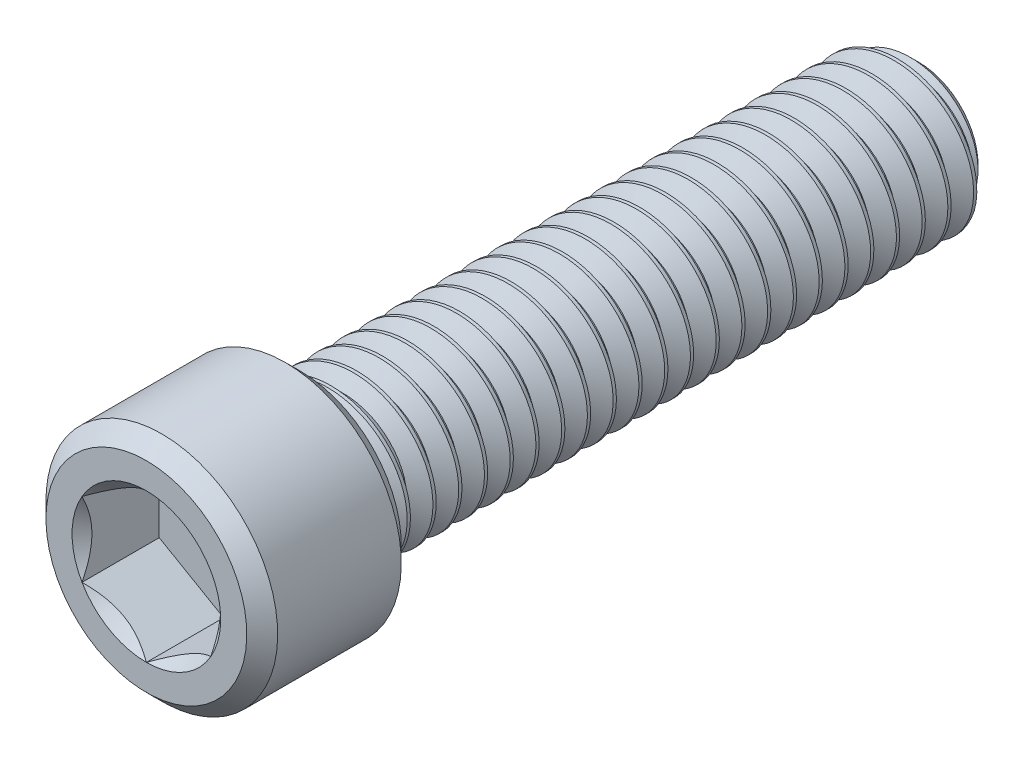
from build123d import *

# Parameters (mm, degrees)
CUT_EXTRUDE1_DEPTH = 4.7625
CUT_SWEEP1_PITCH   = 1.5875
CUT_SWEEP1_TO      = 38.1


with BuildPart() as part:
    # Sketch3 → Revolve1 (revolve)
    with BuildSketch(Plane(origin=(0, 0, 0), x_dir=(0, 0, -1), z_dir=(1, 0, 0))):
        Polygon((23.8125, 0), (-23.8125, 0), (-23.8125, 6.19125), (-22.86, 7.14375), (-15.24, 7.14375), (-14.2875, 6.19125), (-14.2875, 4.7625), (22.70125, 4.7625), (23.8125, 3.65125), align=None)
    revolve(axis=Axis((0, 0, -23.8125), (0, 0, 1)))

    # Sketch4 → Cut-Extrude1 (cut)
    with BuildSketch(Plane.XY.offset(23.8125)):
        Polygon((0, -4.582717762), (3.96875, -2.291358881), (3.96875, 2.291358881), (0, 4.582717762), (-3.96875, 2.291358881), (-3.96875, -2.291358881), align=None)
    extrude(amount=-CUT_EXTRUDE1_DEPTH, mode=Mode.SUBTRACT)

    # Cut-Extrude3 cone 1 section (through the dimple's axis) → Cut-Extrude3 (revolve, cut)
    with BuildSketch(Plane(origin=(0, 0, 23.8125), x_dir=(0, -1, 0), z_dir=(1, 0, 0))):
        Polygon((0, 0), (4.582717762, 0), (0, 4.582717762), align=None)
    revolve(axis=Axis((0, 0, 23.8125), (0, 0, -1)), mode=Mode.SUBTRACT)


with BuildPart() as body_2:
    # Split1: read off the stored shape, not the designer's step
    # Split1: the piece on the far side of the plane
    add(part.part)
    split(bisect_by=Plane.XY.offset(14.2875), keep=Keep.BOTTOM)

    # Cut-Sweep1: arcs per turn and ends read off the stored shape
    # Cut-Sweep1: the profile of Sketch7 screwed along a right-hand helix through 25 turns, 8 arcs to a turn; built about Z, then put on its axis
    cut_sweep1_z = Axis((0, 0, 0), (0, 0, 1))
    cut_sweep1_corners = [(4.848425958, 0, 0.049609375), (4.848425958, 0, -1.438671875), (3.731388504, 0, -0.79375), (3.731388504, 0, -0.5953125)]
    with BuildLine(mode=Mode.PRIVATE) as cut_sweep1_profile:
        Line(cut_sweep1_corners[0], cut_sweep1_corners[1])
        Line(cut_sweep1_corners[1], cut_sweep1_corners[2])
        Line(cut_sweep1_corners[2], cut_sweep1_corners[3])
        Line(cut_sweep1_corners[3], cut_sweep1_corners[0])
    cut_sweep1_cap = Face(cut_sweep1_profile.wire())
    cut_sweep1_turn_angles = [0, 22.5, 45, 67.5, 90, 112.5, 135, 157.5, 180, 202.5, 225, 247.5, 270, 292.5, 315, 337.5, 360]
    cut_sweep1_turn_weights = [1, 0.9238795325112867, 1, 0.9238795325112867, 1, 0.9238795325112867, 1, 0.9238795325112867, 1, 0.9238795325112867, 1, 0.9238795325112867, 1, 0.9238795325112867, 1, 0.9238795325112867, 1]
    cut_sweep1_turn_rails = [Edge.make_bspline([Vector(p[0], p[1], 0).rotate(cut_sweep1_z, cut_sweep1_turn_angles[k]) / cut_sweep1_turn_weights[k] + Vector(0, 0, p[2] + CUT_SWEEP1_PITCH * cut_sweep1_turn_angles[k] / 360) for k in range(17)], [0, 0, 0, 1, 1, 2, 2, 3, 3, 4, 4, 5, 5, 6, 6, 7, 7, 8, 8, 8], 2, cut_sweep1_turn_weights) for p in cut_sweep1_corners]
    cut_sweep1_turn_sides = [Face.make_surface_from_curves(cut_sweep1_turn_rails[p[0]], cut_sweep1_turn_rails[p[1]]) for p in [(0, 1), (1, 2), (2, 3), (3, 0)]]
    cut_sweep1 = Plane(origin=(0, 0, -23.8125), x_dir=(0, 1, 0), z_dir=(0, 0, 1)) * split(Solid(Shell([*[p.moved(Location((0, 0, CUT_SWEEP1_PITCH * i))) for i in range(25) for p in cut_sweep1_turn_sides], cut_sweep1_cap, cut_sweep1_cap.rotate(cut_sweep1_z, 9000).moved(Location((0, 0, CUT_SWEEP1_PITCH * 9000 / 360)))])), bisect_by=Plane.XY.offset(CUT_SWEEP1_TO), keep=Keep.BOTTOM, mode=Mode.PRIVATE)
    add(cut_sweep1, mode=Mode.SUBTRACT)


with BuildPart() as part_1:
    add(part.part)

    # Split1
    split(bisect_by=Plane.XY.offset(14.2875), keep=Keep.TOP)

    add(body_2.part)  # Boss-Extrude1 merges body 2
    # Boss-Extrude1: read off the stored shape, not the designer's step
    # Boss-Extrude1 outline → Boss-Extrude1 (revolve)
    with BuildSketch(Plane.XZ):
        Polygon((3.731388242, 14.2875), (3.731388242, 11.454543727), (4.7625, 14.2875), align=None)
    revolve(axis=Axis((0, 0, 0), (0, 0, 1)))


solid = part_1.part
